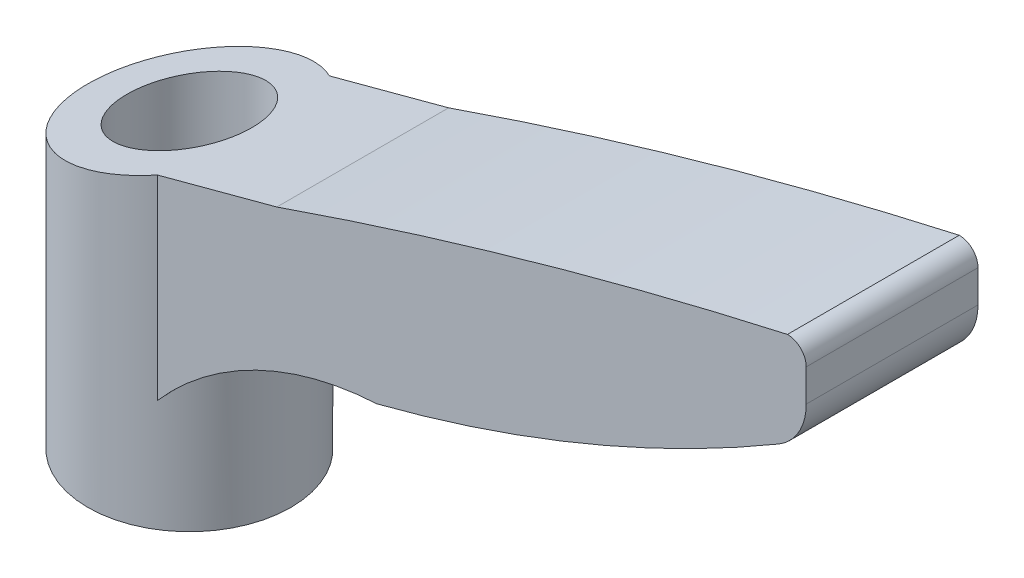
from build123d import *

# Parameters (mm, degrees)
SKETCH_1_W               = 6.5
SKETCH_1_H               = 25.8
EXTRUDE_1_DEPTH          = 5.5
EXTRUDE_1_DEPTH_BACK     = 5.5
CUT_EXTRUDE_1_DEPTH      = 7.5
CUT_EXTRUDE_1_DEPTH_BACK = 7.5


with BuildPart() as part:
    # 草图1 → 旋转1 (revolve)
    with BuildSketch(Plane.XY):
        with Locations((3.25, 16.9)):
            Rectangle(SKETCH_1_W, SKETCH_1_H)
    revolve(axis=Axis((0, 4, 0), (0, 1, 0)))

    # 草图2 → 凸台-拉伸1 (add, two sides: drawn at the far end of the back side and taken through both)
    with BuildSketch(Plane.XY.offset(-EXTRUDE_1_DEPTH_BACK)):
        with BuildLine():
            Line((0, 35), (0, 6))
            Line((0, 6), (0.193705453, 6))
            ThreePointArc((0.193705453, 6), (7.139482491, 14.46235435), (17.5, 18))
            ThreePointArc((17.5, 18), (30.734030931, 22.416195041), (43.224645299, 28.631249829))
            ThreePointArc((43.224645299, 28.631249829), (44.52479784, 29.946946954), (45, 31.734581834))
            Line((45, 31.734581834), (45, 35))
            Line((45, 35), (0, 35))
        make_face()
    extrude(amount=EXTRUDE_1_DEPTH + EXTRUDE_1_DEPTH_BACK)

    # 草图3 → 切除-拉伸1 (cut, two sides: drawn at the far end of the back side and taken through both)
    with BuildSketch(Plane.XY.offset(-CUT_EXTRUDE_1_DEPTH_BACK)):
        with BuildLine():
            Line((-6.5, 45), (-6.5, 21))
            Line((-6.5, 21), (11.1, 25.715905787))
            ThreePointArc((11.1, 25.715905787), (27.318398982, 30.821471809), (43.8, 35))
            ThreePointArc((43.8, 35), (44.648528137, 34.648528137), (45, 33.8))
            Line((45, 33.8), (45, 45))
            Line((45, 45), (-6.5, 45))
        make_face()
    extrude(amount=CUT_EXTRUDE_1_DEPTH + CUT_EXTRUDE_1_DEPTH_BACK, mode=Mode.SUBTRACT)

    # 草图4 → 切除-旋转1 (revolve, cut)
    with BuildSketch(Plane.XY):
        Polygon((0, 0), (-5, 0), (-5, 9.4), (-4, 9.4), (-4, 25.8), (0, 25.8), align=None)
    revolve(axis=Axis((0, 50, 0), (0, -1, 0)), mode=Mode.SUBTRACT)


solid = part.part
